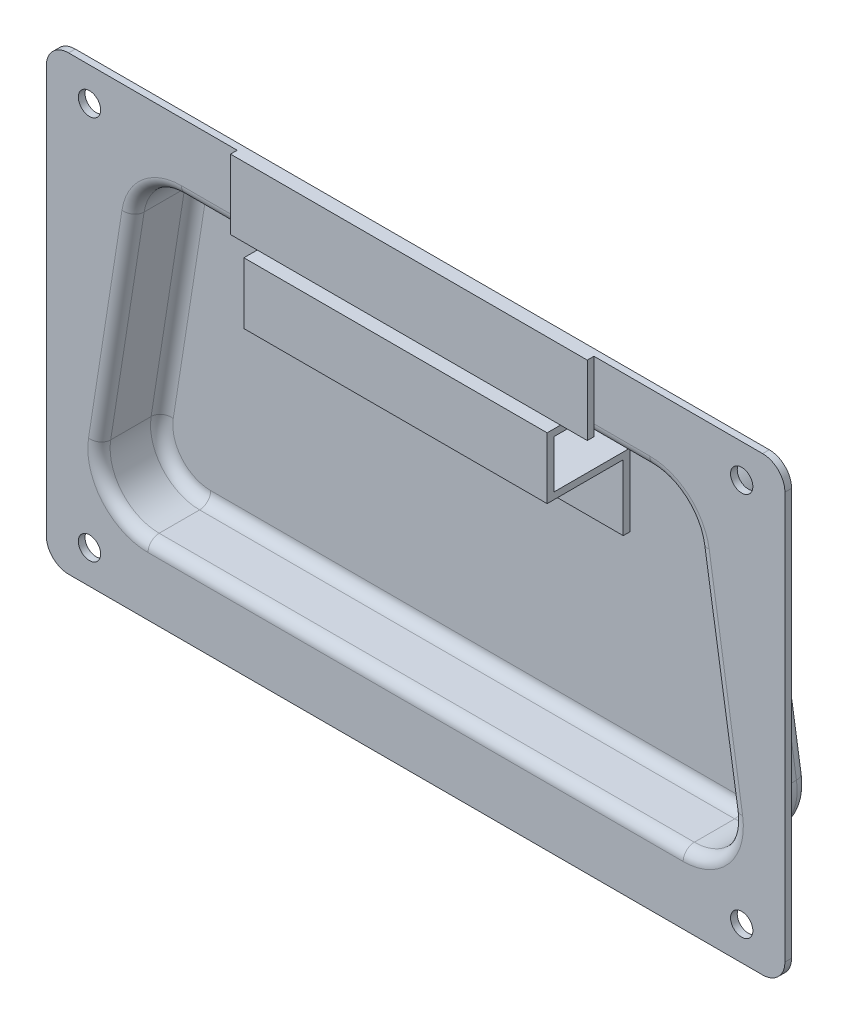
from build123d import *

# Parameters (mm, degrees)
SKETCH1_W                = 132.5
SKETCH1_H                = 81
BOSS_EXTRUDE1_DEPTH      = 1.2
EXTRUDE_THIN1_DEPTH      = 11.25
CUT_EXTRUDE1_DEPTH       = 79.459384397
BOSS_EXTRUDE2_START      = -1.2
BOSS_EXTRUDE2_DEPTH      = 1.2
FILLET1_R                = 2
FILLET2_R                = 4
F_4_0_4_DIAMETER_HOLE1_D = 4
BOSS_EXTRUDE3_DEPTH      = 32
CUT_EXTRUDE3_DEPTH       = 4.8
LPATTERN1_COUNT          = 2
LPATTERN1_PITCH          = 25.5
LPATTERN1_COUNT_DIR2     = 2
LPATTERN1_PITCH_DIR2     = 25.5


with BuildPart() as part:
    # Sketch1 → Boss-Extrude1 (new body)
    with BuildSketch(Plane.XY):
        Rectangle(SKETCH1_W, SKETCH1_H)
    extrude(amount=-BOSS_EXTRUDE1_DEPTH)

    # Sketch2 → Extrude-Thin1 (add)
    with BuildSketch(Plane(origin=(0, 0, -1.2), x_dir=(-1, 0, 0), z_dir=(0, 0, -1))):
        with BuildLine():
            Line((-42, 29.2), (42, 29.2))
            ThreePointArc((42, 29.2), (48.502396173, 26.797291887), (51.880120338, 20.743768803))
            Line((51.880120338, 20.743768803), (57.880120338, -17.656231197))
            ThreePointArc((57.880120338, -17.656231197), (55.597291887, -25.702396173), (48, -29.2))
            Line((48, -29.2), (-48, -29.2))
            ThreePointArc((-48, -29.2), (-55.597291887, -25.702396173), (-57.880120338, -17.656231197))
            Line((-57.880120338, -17.656231197), (-51.880120338, 20.743768803))
            ThreePointArc((-51.880120338, 20.743768803), (-48.502396173, 26.797291887), (-42, 29.2))
        make_face()
        with BuildLine():
            Line((-42, 28), (42, 28))
            ThreePointArc((42, 28), (47.722108632, 25.88561686), (50.694505897, 20.558516546))
            Line((50.694505897, 20.558516546), (56.694505897, -17.841483454))
            ThreePointArc((56.694505897, -17.841483454), (54.68561686, -24.922108632), (48, -28))
            Line((48, -28), (-48, -28))
            ThreePointArc((-48, -28), (-54.68561686, -24.922108632), (-56.694505897, -17.841483454))
            Line((-56.694505897, -17.841483454), (-50.694505897, 20.558516546))
            ThreePointArc((-50.694505897, 20.558516546), (-47.722108632, 25.88561686), (-42, 28))
        make_face(mode=Mode.SUBTRACT)
    extrude(amount=EXTRUDE_THIN1_DEPTH)

    # Sketch3 → Cut-Extrude1 (cut, through all)
    with BuildSketch(Plane(origin=(0, 0, -1.2), x_dir=(-1, 0, 0), z_dir=(0, 0, -1))):
        with BuildLine():
            Line((56.694505897, -17.841483454), (50.694505897, 20.558516546))
            ThreePointArc((50.694505897, 20.558516546), (47.722108632, 25.88561686), (42, 28))
            Line((42, 28), (-42, 28))
            ThreePointArc((-42, 28), (-47.722108632, 25.88561686), (-50.694505897, 20.558516546))
            Line((-50.694505897, 20.558516546), (-56.694505897, -17.841483454))
            ThreePointArc((-56.694505897, -17.841483454), (-54.68561686, -24.922108632), (-48, -28))
            Line((-48, -28), (48, -28))
            ThreePointArc((48, -28), (54.68561686, -24.922108632), (56.694505897, -17.841483454))
        make_face()
    extrude(amount=-CUT_EXTRUDE1_DEPTH, mode=Mode.SUBTRACT)

    # Sketch4 → Boss-Extrude2 (add)
    with BuildSketch(Plane(origin=(0, 0, -12.45), x_dir=(-1, 0, 0), z_dir=(0, 0, -1)).offset(BOSS_EXTRUDE2_START)):
        with BuildLine():
            Line((-51.880120338, 20.743768803), (-57.880120338, -17.656231197))
            ThreePointArc((-57.880120338, -17.656231197), (-55.597291887, -25.702396173), (-48, -29.2))
            Line((-48, -29.2), (48, -29.2))
            ThreePointArc((48, -29.2), (55.597291887, -25.702396173), (57.880120338, -17.656231197))
            Line((57.880120338, -17.656231197), (51.880120338, 20.743768803))
            ThreePointArc((51.880120338, 20.743768803), (48.502396173, 26.797291887), (42, 29.2))
            Line((42, 29.2), (-42, 29.2))
            ThreePointArc((-42, 29.2), (-48.502396173, 26.797291887), (-51.880120338, 20.743768803))
        make_face()
    extrude(amount=BOSS_EXTRUDE2_DEPTH)

    # Fillet1
    fillet1_edges = [part.edges().sort_by_distance(p)[0] for p in [
        (-48.502396173, 26.797291887, -12.45),
        (-54.880120338, 1.543768803, -12.45),
        (-55.597291887, -25.702396173, -12.45),
        (0, -29.2, -12.45),
        (55.597291887, -25.702396173, -12.45),
        (54.880120338, 1.543768803, -12.45),
        (48.502396173, 26.797291887, -12.45),
        (-47.722108632, 25.88561686, 0),
        (-53.694505897, 1.358516546, 0),
        (-54.68561686, -24.922108632, 0),
        (0, -28, 0),
        (54.68561686, -24.922108632, 0),
        (53.694505897, 1.358516546, 0),
        (47.722108632, 25.88561686, 0),
        (0, 29.2, -12.45),
        (0, 28, 0),
        (-47.722108632, 25.88561686, -11.25),
        (-53.694505897, 1.358516546, -11.25),
        (-54.68561686, -24.922108632, -11.25),
        (0, -28, -11.25),
        (54.68561686, -24.922108632, -11.25),
        (53.694505897, 1.358516546, -11.25),
        (47.722108632, 25.88561686, -11.25),
        (48.502396173, 26.797291887, -1.2),
        (0, 29.2, -1.2),
        (-48.502396173, 26.797291887, -1.2),
        (-54.880120338, 1.543768803, -1.2),
        (-55.597291887, -25.702396173, -1.2),
        (0, -29.2, -1.2),
        (55.597291887, -25.702396173, -1.2),
        (0, 28, -11.25),
        (54.880120338, 1.543768803, -1.2),
    ]]
    fillet(fillet1_edges, radius=FILLET1_R)

    # Fillet2
    fillet2_edges = [part.edges().sort_by_distance(p)[0] for p in [
        (-66.25, -40.5, -0.6),
        (-66.25, 40.5, -0.6),
        (66.25, 40.5, -0.6),
        (66.25, -40.5, -0.6),
    ]]
    fillet(fillet2_edges, radius=FILLET2_R)

    # Ø4.0 (4) Diameter Hole1 (through all)
    with Locations(Plane.XY):
        with Locations((-58.5, 34.5), (58.5, 34.5), (58.5, -34.5), (-58.5, -34.5)):
            Hole(F_4_0_4_DIAMETER_HOLE1_D / 2)

    # Sketch7 → Boss-Extrude3 (add, symmetric)
    with BuildSketch(Plane(origin=(0, 0, 0), x_dir=(0, 0, -1), z_dir=(1, 0, 0))):
        Polygon((0, 40.5), (0, 26.8), (-2.4, 26.8), (-2.4, 18.2), (11.25, 18.2), (11.25, 5.2), (10.05, 5.2), (10.05, 17), (-3.6, 17), (-3.6, 28), (-1.2, 28), (-1.2, 40.5), align=None)
    extrude(amount=BOSS_EXTRUDE3_DEPTH, both=True)

    # Sketch9 → Cut-Extrude3 (cut)
    with BuildSketch(Plane.ZY.offset(32)):
        Polygon((2.4, 18.2), (2.4, 26.8), (0, 26.8), (0, 28), (3.6, 28), (3.6, 17), (-10.05, 17), (-10.05, 5.2), (-11.25, 5.2), (-11.25, 18.2), align=None)
    cut_extrude3 = extrude(amount=-CUT_EXTRUDE3_DEPTH, mode=Mode.SUBTRACT)

    # Mirror1: Cut-Extrude3 across plane
    add(cut_extrude3.mirror(Plane(origin=(0, 0, 0), x_dir=(0, 0, 1), z_dir=(1, 0, 0))), mode=Mode.SUBTRACT)

    # Sketch12 → Revolve1 (revolve)
    with BuildSketch(Plane(origin=(0, 0, 0), x_dir=(0, 0, -1), z_dir=(1, 0, 0))):
        with BuildLine():
            Line((12.45, 12.65), (12.748263829, 12.432111783))
            ThreePointArc((12.748263829, 12.432111783), (13.049999993, 11.838013538), (12.748263829, 11.243915294))
            Line((12.748263829, 11.243915294), (12.45, 11.026215316))
            Line((12.45, 11.026215316), (12.45, 12.65))
        make_face()
    revolve1 = revolve(axis=Axis((0, 9.5, -12.45), (0, 0, -1)))

    # LPattern1: Revolve1 2 × 2, 1 skipped
    with Locations(*[Vector(-1, 0, 0) * (i * LPATTERN1_PITCH) + Vector(1, 0, 0) * (j * LPATTERN1_PITCH_DIR2) for i in range(LPATTERN1_COUNT) for j in range(LPATTERN1_COUNT_DIR2) if (i, j) not in ((0, 0), (1, 1))]):
        add(revolve1)


solid = part.part
